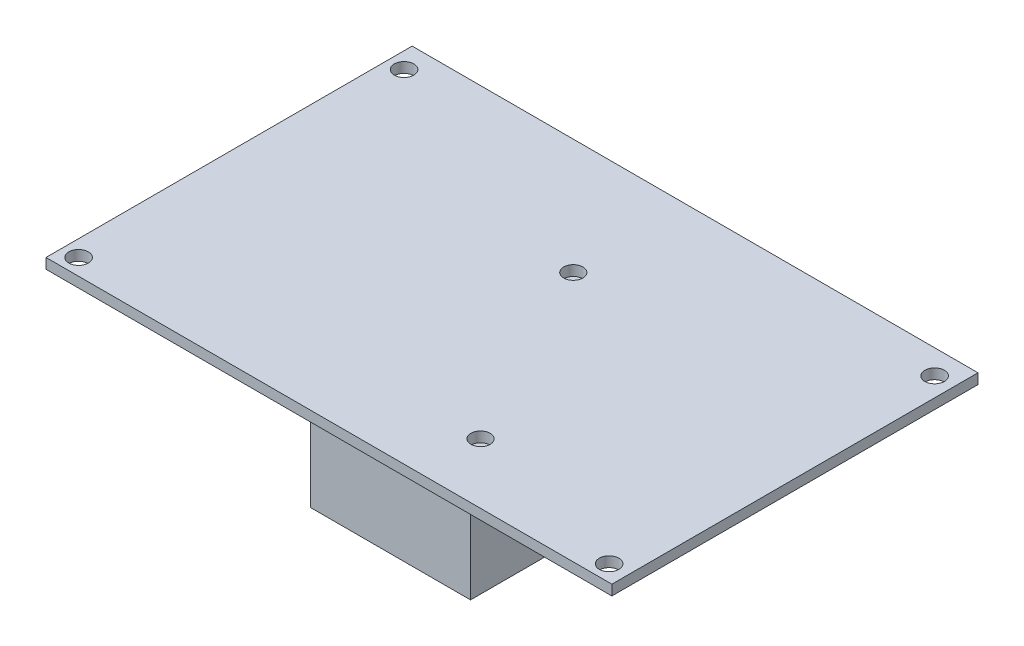
from build123d import *

# Parameters (mm, degrees)
SKICA2_W                = 88.316
SKICA2_H                = 57.14
SKICA2_R                = 1.524
SKICA2_R_2              = 1.5
P_IDAT_VYSUNUT_M1_DEPTH = 1.6
SKICA3_W                = 24.937975946
SKICA3_H                = 40.524210912
P_IDAT_VYSUNUT_M2_DEPTH = 15


with BuildPart() as part:
    # Skica2 → Přidat vysunutím1 (new body)
    with BuildSketch(Plane(origin=(0, 0, 0), x_dir=(1, 0, 0), z_dir=(0, 1, 0))):
        with Locations((45.682, 37.206)):
            Rectangle(SKICA2_W, SKICA2_H)
        with Locations((4.064, 61.976)):
            Circle(SKICA2_R, mode=Mode.SUBTRACT)
        with Locations((4.064, 11.176)):
            Circle(SKICA2_R, mode=Mode.SUBTRACT)
        with Locations((86.868, 11.176)):
            Circle(SKICA2_R, mode=Mode.SUBTRACT)
        with Locations((86.868, 61.976)):
            Circle(SKICA2_R, mode=Mode.SUBTRACT)
        with Locations((59.944, 18.034)):
            Circle(SKICA2_R_2, mode=Mode.SUBTRACT)
        with Locations((44.704, 47.752)):
            Circle(SKICA2_R_2, mode=Mode.SUBTRACT)
    extrude(amount=P_IDAT_VYSUNUT_M1_DEPTH)

    # Skica3 → Přidat vysunutím2 (add)
    with BuildSketch(Plane.XZ):
        with Locations((51.871314804, -32.337831123)):
            Rectangle(SKICA3_W, SKICA3_H)
    extrude(amount=P_IDAT_VYSUNUT_M2_DEPTH)


solid = part.part
